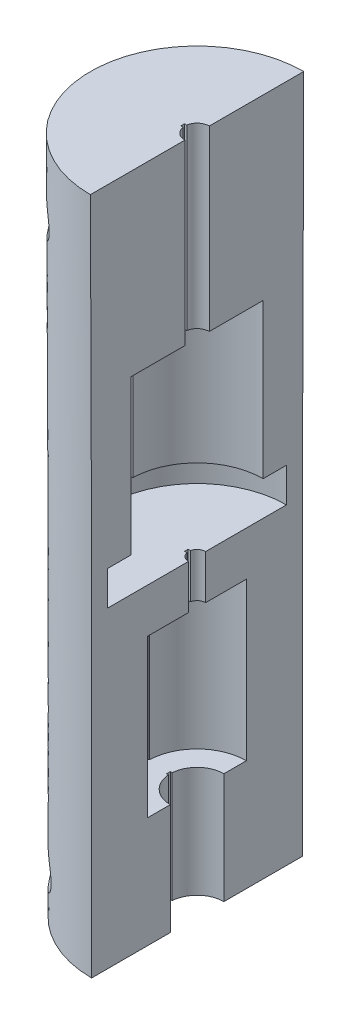
from build123d import *

# Parameters (mm, degrees)
SKETCH3_W           = 21.993363762
SKETCH3_H           = 30.202832843
CUT_EXTRUDE1_DEPTH  = 100
SKETCH5_R           = 3.75
CUT_EXTRUDE4_DEPTH  = 15.5
SKETCH6_R           = 6.9
CUT_EXTRUDE5_DEPTH  = 22
SKETCH7_R           = 1.2
CUT_EXTRUDE6_DEPTH  = 6.2
SKETCH8_R           = 12.5
CUT_EXTRUDE7_DEPTH  = 4.8
SKETCH9_R           = 9.25
CUT_EXTRUDE8_DEPTH  = 21.6
SKETCH10_R          = 1.71
CUT_EXTRUDE9_DEPTH  = 40
SKETCH12_W          = 0.5
SKETCH12_H          = 24.9
CUT_EXTRUDE10_DEPTH = 2
SKETCH13_W          = 0.5
SKETCH13_H          = 21.6
CUT_EXTRUDE11_DEPTH = 10
SKETCH14_W          = 0.5
SKETCH14_H          = 4.8
CUT_EXTRUDE12_DEPTH = 12.5
SKETCH15_W          = 0.5
SKETCH15_H          = 6.2
CUT_EXTRUDE13_DEPTH = 1.5
SKETCH16_W          = 0.500221157
SKETCH16_H          = 22
CUT_EXTRUDE14_DEPTH = 7
SKETCH17_W          = 0.505614017
SKETCH17_H          = 15.5
CUT_EXTRUDE15_DEPTH = 4
CUT_EXTRUDE16_START = -1
SKETCH18_R          = 3
CUT_EXTRUDE16_DEPTH = 15


with BuildPart() as part:
    # Loft1: read off the stored shape, not the designer's step
    # Loft1: loft between two sections, ruled curve by curve
    loft1_from = [
        Edge.make_bspline([(-4.381363328, 0, -14.084252035), (-32.549867398, 0, -5.321525378), (-23.787140742, 0, 22.846978692), (4.381363328, 0, 14.084252035), (32.549867398, 0, 5.321525378), (23.787140742, 0, -22.846978692), (-4.381363328, 0, -14.084252035)], [0, 0, 0, 0, 0.5, 0.5, 0.5, 1, 1, 1, 1], 3, [1, 0.333333333, 0.333333333, 1, 0.333333333, 0.333333333, 1]),
    ]
    loft1_to = [
        Edge.make_bspline([(-7.165507724, 95, -13.092407115), (-33.350321953, 95, 1.238608334), (-19.019306505, 95, 27.423422563), (7.165507724, 95, 13.092407115), (33.350321953, 95, -1.238608334), (19.019306505, 95, -27.423422563), (-7.165507724, 95, -13.092407115)], [0, 0, 0, 0, 0.5, 0.5, 0.5, 1, 1, 1, 1], 3, [1, 0.333333333, 0.333333333, 1, 0.333333333, 0.333333333, 1]),
    ]
    loft1 = Solid(Shell([*[Face.make_surface_from_curves(loft1_from[k], loft1_to[k]) for k in range(1)], Face(Wire(loft1_from)), Face(Wire(loft1_to))]))
    add(loft1)

    # Sketch3 → Cut-Extrude1 (cut)
    with BuildSketch(Plane(origin=(0, 0, 0), x_dir=(1, 0, 0), z_dir=(0, 1, 0))):
        with Locations((10.996681881, -0.176416421)):
            Rectangle(SKETCH3_W, SKETCH3_H)
    extrude(amount=CUT_EXTRUDE1_DEPTH, mode=Mode.SUBTRACT)

    # Sketch5 → Cut-Extrude4 (cut)
    with BuildSketch(Plane(origin=(0, 0, 0), x_dir=(1, 0, 0), z_dir=(0, 1, 0))):
        Circle(SKETCH5_R)
    extrude(amount=CUT_EXTRUDE4_DEPTH, mode=Mode.SUBTRACT)

    # Sketch6 → Cut-Extrude5 (cut)
    with BuildSketch(Plane(origin=(0, 15.5, 0), x_dir=(-1, 0, 0), z_dir=(0, -1, 0))):
        Circle(SKETCH6_R)
    extrude(amount=-CUT_EXTRUDE5_DEPTH, mode=Mode.SUBTRACT)

    # Sketch7 → Cut-Extrude6 (cut)
    with BuildSketch(Plane(origin=(0, 37.5, 0), x_dir=(-1, 0, 0), z_dir=(0, -1, 0))):
        Circle(SKETCH7_R)
    extrude(amount=-CUT_EXTRUDE6_DEPTH, mode=Mode.SUBTRACT)

    # Sketch8 → Cut-Extrude7 (cut)
    with BuildSketch(Plane(origin=(0, 43.7, 0), x_dir=(-1, 0, 0), z_dir=(0, -1, 0))):
        Circle(SKETCH8_R)
    extrude(amount=-CUT_EXTRUDE7_DEPTH, mode=Mode.SUBTRACT)

    # Sketch9 → Cut-Extrude8 (cut)
    with BuildSketch(Plane(origin=(0, 48.5, 0), x_dir=(-1, 0, 0), z_dir=(0, -1, 0))):
        Circle(SKETCH9_R)
    extrude(amount=-CUT_EXTRUDE8_DEPTH, mode=Mode.SUBTRACT)

    # Sketch10 → Cut-Extrude9 (cut)
    with BuildSketch(Plane(origin=(0, 95, 0), x_dir=(1, 0, 0), z_dir=(0, 1, 0))):
        Circle(SKETCH10_R)
    extrude(amount=-CUT_EXTRUDE9_DEPTH, mode=Mode.SUBTRACT)

    # Sketch12 → Cut-Extrude10 (cut)
    with BuildSketch(Plane(origin=(0, 0, 0), x_dir=(0, 0, -1), z_dir=(1, 0, 0))):
        with Locations((0, 82.55)):
            Rectangle(SKETCH12_W, SKETCH12_H)
    extrude(amount=-CUT_EXTRUDE10_DEPTH, mode=Mode.SUBTRACT)

    # Sketch13 → Cut-Extrude11 (cut)
    with BuildSketch(Plane(origin=(0, 0, 0), x_dir=(0, 0, -1), z_dir=(1, 0, 0))):
        with Locations((0, 59.3)):
            Rectangle(SKETCH13_W, SKETCH13_H)
    extrude(amount=-CUT_EXTRUDE11_DEPTH, mode=Mode.SUBTRACT)

    # Sketch14 → Cut-Extrude12 (cut)
    with BuildSketch(Plane(origin=(0, 0, 0), x_dir=(0, 0, -1), z_dir=(1, 0, 0))):
        with Locations((0, 46.1)):
            Rectangle(SKETCH14_W, SKETCH14_H)
    extrude(amount=-CUT_EXTRUDE12_DEPTH, mode=Mode.SUBTRACT)

    # Sketch15 → Cut-Extrude13 (cut)
    with BuildSketch(Plane(origin=(0, 0, 0), x_dir=(0, 0, -1), z_dir=(1, 0, 0))):
        with Locations((0, 40.6)):
            Rectangle(SKETCH15_W, SKETCH15_H)
    extrude(amount=-CUT_EXTRUDE13_DEPTH, mode=Mode.SUBTRACT)

    # Sketch16 → Cut-Extrude14 (cut)
    with BuildSketch(Plane(origin=(0, 0, 0), x_dir=(0, 0, -1), z_dir=(1, 0, 0))):
        with Locations((0.000110579, 26.5)):
            Rectangle(SKETCH16_W, SKETCH16_H)
    extrude(amount=-CUT_EXTRUDE14_DEPTH, mode=Mode.SUBTRACT)

    # Sketch17 → Cut-Extrude15 (cut)
    with BuildSketch(Plane(origin=(0, 0, 0), x_dir=(0, 0, -1), z_dir=(1, 0, 0))):
        with Locations((-0.002585851, 7.75)):
            Rectangle(SKETCH17_W, SKETCH17_H)
    extrude(amount=-CUT_EXTRUDE15_DEPTH, mode=Mode.SUBTRACT)

    # Sketch18 → Cut-Extrude16 (cut)
    with BuildSketch(Plane(origin=(0, 0, 0), x_dir=(0, 0, -1), z_dir=(1, 0, 0)).offset(CUT_EXTRUDE16_START)):
        with Locations((-9.326204078, 6.12452291)):
            Circle(SKETCH18_R)
        with Locations((-9.25, 84.904010386)):
            Circle(SKETCH18_R)
        with Locations((9.326204078, 6.12452291)):
            Circle(SKETCH18_R)
        with Locations((9.25, 84.904010386)):
            Circle(SKETCH18_R)
    extrude(amount=-CUT_EXTRUDE16_DEPTH, mode=Mode.SUBTRACT)


solid = part.part
